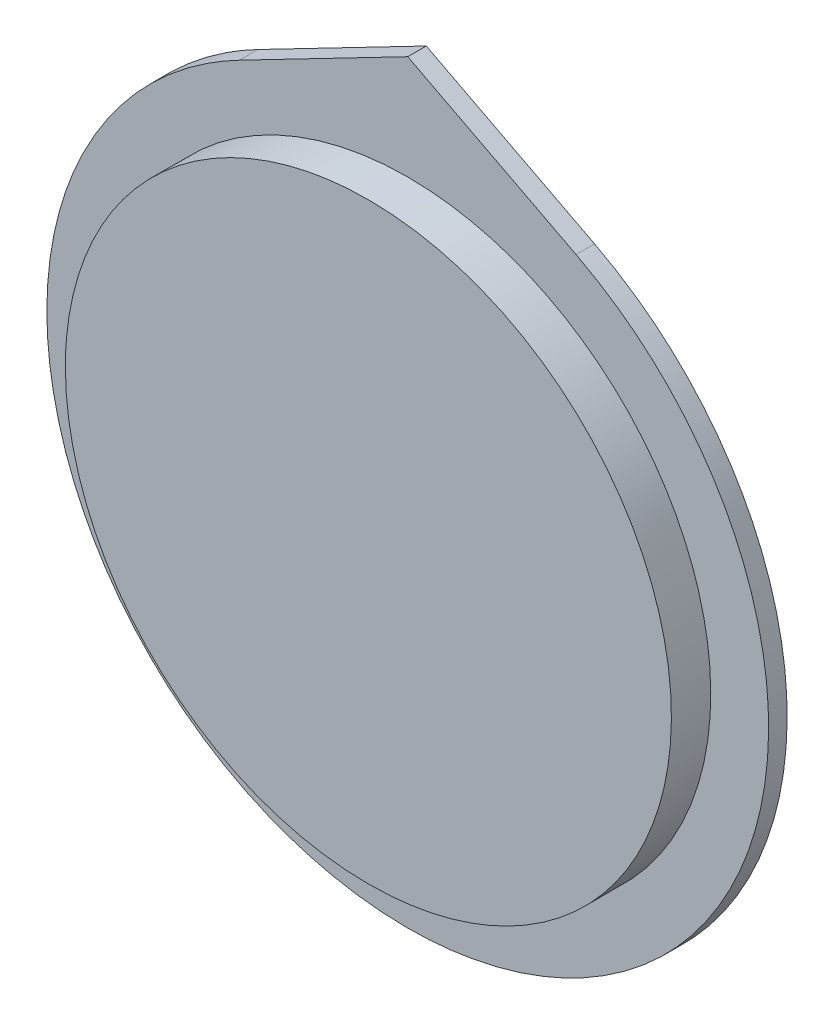
from build123d import *

# Parameters (mm, degrees)
SKETCH1_RX          = 16.6243
SKETCH1_RY          = 16.256
BOSS_EXTRUDE1_DEPTH = 3.175
BOSS_EXTRUDE2_START = -1.016
BOSS_EXTRUDE2_DEPTH = 1.016
EXTRUDE_THIN1_DEPTH = 1.016


# Read off the part's stored shape, not the designer's step: Boss-Extrude2
with BuildPart() as part:
    # Sketch1 → Boss-Extrude1 (new body)
    with BuildSketch(Plane.XY):
        with Locations(Location((0, 0), (0, 0, 180))):
            Ellipse(SKETCH1_RX, SKETCH1_RY)
    extrude(amount=BOSS_EXTRUDE1_DEPTH)

    # Boss-Extrude2 outline → Boss-Extrude2 (add)
    with BuildSketch(Plane(origin=(0, 0, 0), x_dir=(-1, 0, 0), z_dir=(0, 0, -1)).offset(BOSS_EXTRUDE2_START)):
        with BuildLine():
            add(Edge.make_bspline(
                [(19.7993, 0), (19.7993, 2.552483898), (18.759870787, 7.657451695), (14.33574923, 14.125999508), (7.746727593, 18.427331983), (0, 19.932834008), (-7.746727593, 18.427331983), (-14.33574923, 14.125999508), (-18.759870787, 7.657451695), (-20.319014606, 0), (-18.759870787, -7.657451695), (-14.33574923, -14.125999508), (-7.746727593, -18.427331983), (0, -19.932834008), (7.746727593, -18.427331983), (14.33574923, -14.125999508), (18.759870787, -7.657451695), (19.7993, -2.552483898), (19.7993, 0)],
                knots=[0, 0, 0, 0, 0.392699082, 0.785398163, 1.178097245, 1.570796327, 1.963495408, 2.35619449, 2.748893572, 3.141592654, 3.534291735, 3.926990817, 4.319689899, 4.71238898, 5.105088062, 5.497787144, 5.890486225, 6.283185307, 6.283185307, 6.283185307, 6.283185307], degree=3))
        make_face()
        with BuildLine():
            add(Edge.make_bspline(
                [(16.6243, 0), (16.6243, -28.156217928), (-8.31215, -14.078108964), (-33.2486, 0), (-8.31215, 14.078108964), (16.6243, 28.156217928), (16.6243, 0)],
                knots=[0, 0, 0, 2.094395102, 2.094395102, 4.188790205, 4.188790205, 6.283185307, 6.283185307, 6.283185307], degree=2, weights=[1, 0.5, 1, 0.5, 1, 0.5, 1]))
        make_face(mode=Mode.SUBTRACT)
    extrude(amount=BOSS_EXTRUDE2_DEPTH)

    # Sketch3 → Extrude-Thin1 (add)
    with BuildSketch(Plane(origin=(0, 0, 0), x_dir=(-1, 0, 0), z_dir=(0, 0, -1))):
        Polygon((-9.233767153, 17.187871189), (0, 21.971), (9.233767153, 17.187871189), (8.065476101, 14.932500706), (0, 19.110450016), (-8.065476101, 14.932500706), align=None)
    extrude(amount=-EXTRUDE_THIN1_DEPTH)


solid = part.part
